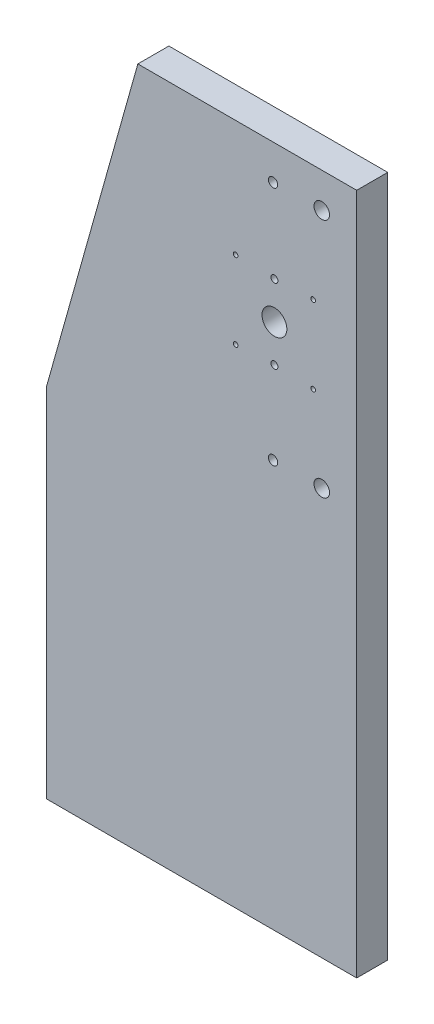
from build123d import *

# Parameters (mm, degrees)
SKETCH1_R                  = 8
SKETCH1_R_2                = 5
SKETCH1_R_3                = 2.25
SKETCH1_R_4                = 1.5
SKETCH1_R_5                = 3
EXTRUDE1_DEPTH             = 20
CUT_EXTRUDE1_START         = -10
CUT_EXTRUDE1_OUTLINE_R     = 8
CUT_EXTRUDE1_OUTLINE_R_2   = 5
CUT_EXTRUDE1_DEPTH         = 10
CUT_EXTRUDE1_START_2       = -6
CUT_EXTRUDE1_2_OUTLINE_R   = 5
CUT_EXTRUDE1_2_OUTLINE_R_2 = 3
CUT_EXTRUDE1_2_DEPTH       = 6
CUT_EXTRUDE1_3_OUTLINE_R   = 3.25
CUT_EXTRUDE1_3_DEPTH       = 60


# Read off the part's stored shape, not the designer's step: Cut-Extrude1
with BuildPart() as part:
    # Sketch1 → Extrude1 (new body)
    with BuildSketch(Plane.XY):
        Polygon((38.999908, 439.49994136), (-20, 229.49994136), (-20, 0), (180, 0), (180, 20), (180, 439.50001453), align=None)
        with Locations((126.999908, 339.49994136)):
            Circle(SKETCH1_R, mode=Mode.SUBTRACT)
        with Locations((157.49992067, 416.99997068)):
            Circle(SKETCH1_R_2, mode=Mode.SUBTRACT)
        with Locations((126.999908, 363.49994136)):
            Circle(SKETCH1_R_3, mode=Mode.SUBTRACT)
        with Locations((126.999908, 315.49994136)):
            Circle(SKETCH1_R_3, mode=Mode.SUBTRACT)
        with Locations((157.49992067, 261.99991204)):
            Circle(SKETCH1_R_2, mode=Mode.SUBTRACT)
        with Locations((151.999908, 364.49994136)):
            Circle(SKETCH1_R_4, mode=Mode.SUBTRACT)
        with Locations((151.999908, 314.49994136)):
            Circle(SKETCH1_R_4, mode=Mode.SUBTRACT)
        with Locations((101.999908, 364.49994136)):
            Circle(SKETCH1_R_4, mode=Mode.SUBTRACT)
        with Locations((101.999908, 314.49994136)):
            Circle(SKETCH1_R_4, mode=Mode.SUBTRACT)
        with Locations((126.12492067, 416.99997068)):
            Circle(SKETCH1_R_5, mode=Mode.SUBTRACT)
        with Locations((126.12492067, 261.99991204)):
            Circle(SKETCH1_R_5, mode=Mode.SUBTRACT)
    extrude(amount=EXTRUDE1_DEPTH)

    # Cut-Extrude1 outline → Cut-Extrude1 (cut)
    # profile 1 of 2: a face of its own
    with BuildSketch(Plane(origin=(0, 0, 0), x_dir=(-1, 0, 0), z_dir=(0, 0, -1)).offset(CUT_EXTRUDE1_START)):
        with Locations((-157.49992067, 416.99997068)):
            Circle(CUT_EXTRUDE1_OUTLINE_R)
        with Locations((-157.49992067, 416.99997068)):
            Circle(CUT_EXTRUDE1_OUTLINE_R_2, mode=Mode.SUBTRACT)
    # profile 2 of 2: a face of its own
    with BuildSketch(Plane(origin=(0, 0, 0), x_dir=(-1, 0, 0), z_dir=(0, 0, -1)).offset(CUT_EXTRUDE1_START)):
        with Locations((-157.49992067, 261.99991204)):
            Circle(CUT_EXTRUDE1_OUTLINE_R)
        with Locations((-157.49992067, 261.99991204)):
            Circle(CUT_EXTRUDE1_OUTLINE_R_2, mode=Mode.SUBTRACT)
    extrude(amount=CUT_EXTRUDE1_DEPTH, mode=Mode.SUBTRACT)

    # Cut-Extrude1 2 outline → Cut-Extrude1 2 (cut)
    # profile 1 of 2: a face of its own
    with BuildSketch(Plane(origin=(0, 0, 0), x_dir=(-1, 0, 0), z_dir=(0, 0, -1)).offset(CUT_EXTRUDE1_START_2)):
        with Locations((-126.12492067, 416.99997068)):
            Circle(CUT_EXTRUDE1_2_OUTLINE_R)
        with Locations((-126.12492067, 416.99997068)):
            Circle(CUT_EXTRUDE1_2_OUTLINE_R_2, mode=Mode.SUBTRACT)
    # profile 2 of 2: a face of its own
    with BuildSketch(Plane(origin=(0, 0, 0), x_dir=(-1, 0, 0), z_dir=(0, 0, -1)).offset(CUT_EXTRUDE1_START_2)):
        with Locations((-126.12492067, 261.99991204)):
            Circle(CUT_EXTRUDE1_2_OUTLINE_R)
        with Locations((-126.12492067, 261.99991204)):
            Circle(CUT_EXTRUDE1_2_OUTLINE_R_2, mode=Mode.SUBTRACT)
    extrude(amount=CUT_EXTRUDE1_2_DEPTH, mode=Mode.SUBTRACT)

    # Cut-Extrude1 3 outline → Cut-Extrude1 3 (cut)
    with BuildSketch(Plane(origin=(0, 0, 0), x_dir=(1, 0, 0), z_dir=(0, 1, 0))):
        with Locations((20, -10)):
            Circle(CUT_EXTRUDE1_3_OUTLINE_R)
        with Locations((40, -10)):
            Circle(CUT_EXTRUDE1_3_OUTLINE_R)
        with Locations((60, -10)):
            Circle(CUT_EXTRUDE1_3_OUTLINE_R)
        with Locations((80, -10)):
            Circle(CUT_EXTRUDE1_3_OUTLINE_R)
        with Locations((100, -10)):
            Circle(CUT_EXTRUDE1_3_OUTLINE_R)
        with Locations((120, -10)):
            Circle(CUT_EXTRUDE1_3_OUTLINE_R)
        with Locations((140, -10)):
            Circle(CUT_EXTRUDE1_3_OUTLINE_R)
        with Locations((160, -10)):
            Circle(CUT_EXTRUDE1_3_OUTLINE_R)
        with Locations((0, -10)):
            Circle(CUT_EXTRUDE1_3_OUTLINE_R)
    extrude(amount=CUT_EXTRUDE1_3_DEPTH, mode=Mode.SUBTRACT)


solid = part.part
